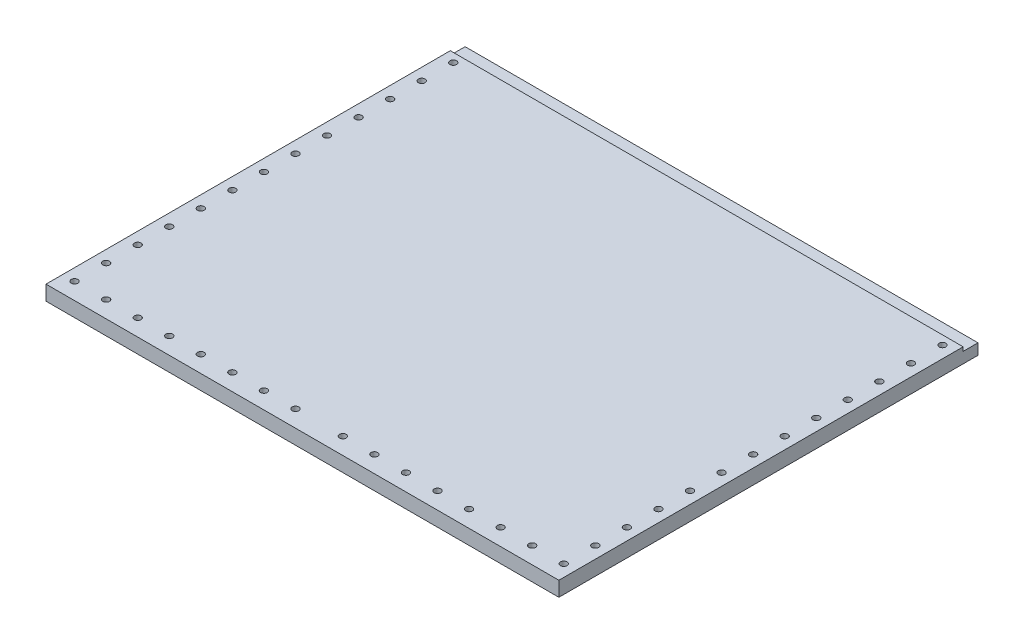
from build123d import *

# Parameters (mm, degrees)
SKETCH1_W           = 412.75
SKETCH1_H           = 584.2
BOSS_EXTRUDE1_DEPTH = 11.90625
SKETCH2_W           = 40.64
SKETCH2_H           = 139.7
CUT_EXTRUDE1_DEPTH  = 716.397764386
SKETCH3_R           = 2.667
CUT_EXTRUDE2_DEPTH  = 254
SKETCH4_W           = 412.75
SKETCH4_H           = 246.888
CUT_EXTRUDE4_DEPTH  = 716.397764386
SKETCH5_W           = 11.938
SKETCH5_H           = 3.175
CUT_EXTRUDE5_DEPTH  = 534.18262034


with BuildPart() as part:
    # Sketch1 → Boss-Extrude1 (new body)
    with BuildSketch(Plane(origin=(0, 0, 0), x_dir=(1, 0, 0), z_dir=(0, 1, 0))):
        with Locations((206.375, 292.1)):
            Rectangle(SKETCH1_W, SKETCH1_H)
    extrude(amount=BOSS_EXTRUDE1_DEPTH)

    # Sketch2 → Cut-Extrude1 (cut, through all)
    with BuildSketch(Plane(origin=(0, 11.90625, 0), x_dir=(1, 0, 0), z_dir=(0, 1, 0))):
        with Locations((20.32, 407.162)):
            Rectangle(SKETCH2_W, SKETCH2_H)
        with Locations((392.43, 407.162)):
            Rectangle(SKETCH2_W, SKETCH2_H)
    extrude(amount=-CUT_EXTRUDE1_DEPTH, mode=Mode.SUBTRACT)

    # Sketch3 → Cut-Extrude2 (cut)
    with BuildSketch(Plane(origin=(0, 11.90625, 0), x_dir=(1, 0, 0), z_dir=(0, 1, 0))):
        with Locations((9.525, 13.462)):
            Circle(SKETCH3_R)
        with Locations((34.925, 13.462)):
            Circle(SKETCH3_R)
        with Locations((60.325, 13.462)):
            Circle(SKETCH3_R)
        with Locations((85.725, 13.462)):
            Circle(SKETCH3_R)
        with Locations((111.125, 13.462)):
            Circle(SKETCH3_R)
        with Locations((136.525, 13.462)):
            Circle(SKETCH3_R)
        with Locations((161.925, 13.462)):
            Circle(SKETCH3_R)
        with Locations((187.325, 13.462)):
            Circle(SKETCH3_R)
        with Locations((225.425, 13.462)):
            Circle(SKETCH3_R)
        with Locations((250.825, 13.462)):
            Circle(SKETCH3_R)
        with Locations((276.225, 13.462)):
            Circle(SKETCH3_R)
        with Locations((301.625, 13.462)):
            Circle(SKETCH3_R)
        with Locations((327.025, 13.462)):
            Circle(SKETCH3_R)
        with Locations((352.425, 13.462)):
            Circle(SKETCH3_R)
        with Locations((377.825, 13.462)):
            Circle(SKETCH3_R)
        with Locations((403.225, 13.462)):
            Circle(SKETCH3_R)
        with Locations((403.225, 38.862)):
            Circle(SKETCH3_R)
        with Locations((403.225, 64.262)):
            Circle(SKETCH3_R)
        with Locations((403.225, 89.662)):
            Circle(SKETCH3_R)
        with Locations((403.225, 115.062)):
            Circle(SKETCH3_R)
        with Locations((403.225, 140.462)):
            Circle(SKETCH3_R)
        with Locations((403.225, 165.862)):
            Circle(SKETCH3_R)
        with Locations((403.225, 191.262)):
            Circle(SKETCH3_R)
        with Locations((403.225, 216.662)):
            Circle(SKETCH3_R)
        with Locations((403.225, 242.062)):
            Circle(SKETCH3_R)
        with Locations((403.225, 267.462)):
            Circle(SKETCH3_R)
        with Locations((403.225, 292.862)):
            Circle(SKETCH3_R)
        with Locations((403.225, 318.262)):
            Circle(SKETCH3_R)
        with Locations((403.225, 343.662)):
            Circle(SKETCH3_R)
        with Locations((403.225, 369.062)):
            Circle(SKETCH3_R)
        with Locations((403.225, 394.462)):
            Circle(SKETCH3_R)
        with Locations((403.225, 419.862)):
            Circle(SKETCH3_R)
        with Locations((403.225, 445.262)):
            Circle(SKETCH3_R)
        with Locations((403.225, 470.662)):
            Circle(SKETCH3_R)
        with Locations((403.225, 496.062)):
            Circle(SKETCH3_R)
        with Locations((403.225, 521.462)):
            Circle(SKETCH3_R)
        with Locations((403.225, 546.862)):
            Circle(SKETCH3_R)
        with Locations((403.225, 572.262)):
            Circle(SKETCH3_R)
        with Locations((9.525, 38.862)):
            Circle(SKETCH3_R)
        with Locations((9.525, 64.262)):
            Circle(SKETCH3_R)
        with Locations((9.525, 89.662)):
            Circle(SKETCH3_R)
        with Locations((9.525, 115.062)):
            Circle(SKETCH3_R)
        with Locations((9.525, 140.462)):
            Circle(SKETCH3_R)
        with Locations((9.525, 165.862)):
            Circle(SKETCH3_R)
        with Locations((9.525, 191.262)):
            Circle(SKETCH3_R)
        with Locations((9.525, 216.662)):
            Circle(SKETCH3_R)
        with Locations((9.525, 242.062)):
            Circle(SKETCH3_R)
        with Locations((9.525, 267.462)):
            Circle(SKETCH3_R)
        with Locations((9.525, 292.862)):
            Circle(SKETCH3_R)
        with Locations((9.525, 318.262)):
            Circle(SKETCH3_R)
        with Locations((9.525, 343.662)):
            Circle(SKETCH3_R)
        with Locations((9.525, 369.062)):
            Circle(SKETCH3_R)
        with Locations((9.525, 394.462)):
            Circle(SKETCH3_R)
        with Locations((9.525, 419.862)):
            Circle(SKETCH3_R)
        with Locations((9.525, 445.262)):
            Circle(SKETCH3_R)
        with Locations((9.525, 470.662)):
            Circle(SKETCH3_R)
        with Locations((9.525, 496.062)):
            Circle(SKETCH3_R)
        with Locations((9.525, 521.462)):
            Circle(SKETCH3_R)
        with Locations((9.525, 546.862)):
            Circle(SKETCH3_R)
        with Locations((9.525, 572.262)):
            Circle(SKETCH3_R)
    extrude(amount=-CUT_EXTRUDE2_DEPTH, mode=Mode.SUBTRACT)

    # Sketch4 → Cut-Extrude4 (cut, through all)
    with BuildSketch(Plane(origin=(0, 11.90625, 0), x_dir=(1, 0, 0), z_dir=(0, 1, 0))):
        with Locations((206.375, 460.756)):
            Rectangle(SKETCH4_W, SKETCH4_H)
    extrude(amount=-CUT_EXTRUDE4_DEPTH, mode=Mode.SUBTRACT)

    # Sketch5 → Cut-Extrude5 (cut, through all)
    with BuildSketch(Plane(origin=(412.75, 0, 0), x_dir=(0, 0, -1), z_dir=(1, 0, 0))):
        with Locations((331.343, 10.31875)):
            Rectangle(SKETCH5_W, SKETCH5_H)
    extrude(amount=-CUT_EXTRUDE5_DEPTH, mode=Mode.SUBTRACT)


solid = part.part
